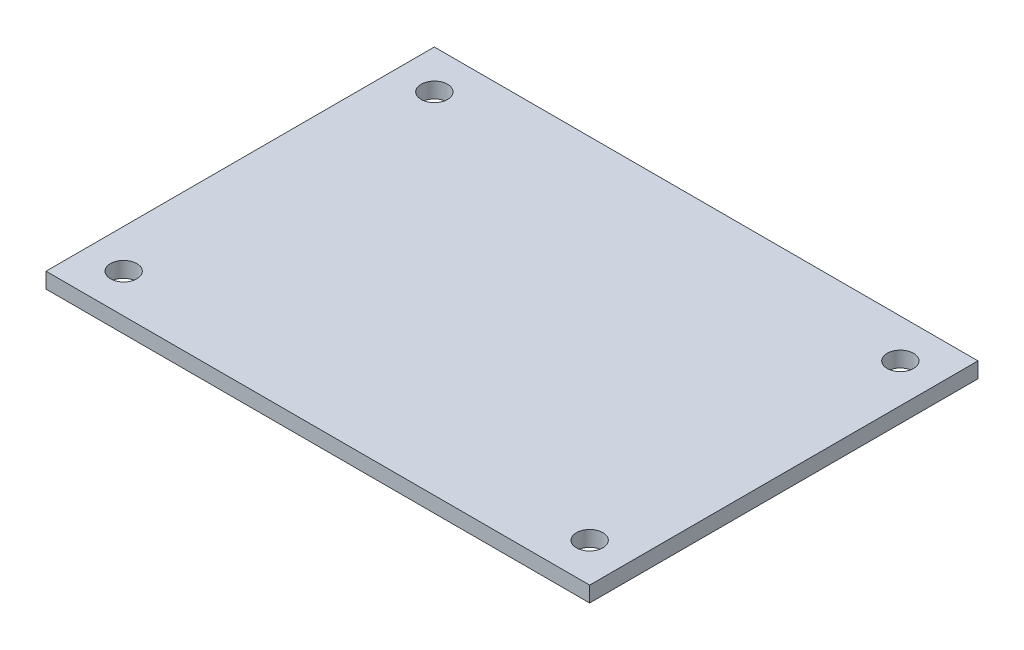
from build123d import *

# Parameters (mm, degrees)
SKETCH1_W           = 70
SKETCH1_H           = 50
SKETCH1_R           = 1.7
BOSS_EXTRUDE1_DEPTH = 2


with BuildPart() as part:
    # Sketch1 → Boss-Extrude1 (new body)
    with BuildSketch(Plane(origin=(0, 0, 0), x_dir=(1, 0, 0), z_dir=(0, 1, 0))):
        Rectangle(SKETCH1_W, SKETCH1_H)
        with Locations((-30, 20)):
            Circle(SKETCH1_R, mode=Mode.SUBTRACT)
        with Locations((30, 20)):
            Circle(SKETCH1_R, mode=Mode.SUBTRACT)
        with Locations((30, -20)):
            Circle(SKETCH1_R, mode=Mode.SUBTRACT)
        with Locations((-30, -20)):
            Circle(SKETCH1_R, mode=Mode.SUBTRACT)
    extrude(amount=BOSS_EXTRUDE1_DEPTH)


solid = part.part
